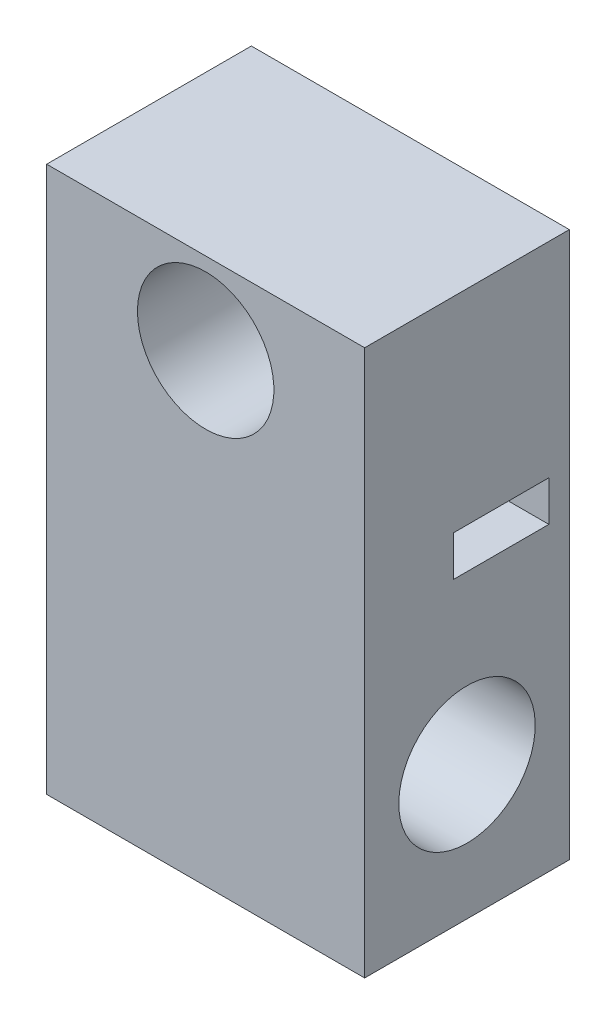
from build123d import *

# Parameters (mm, degrees)
SKETCH1_W           = 29.59652174
SKETCH1_H           = 50.8
SKETCH1_R           = 6.35
BOSS_EXTRUDE1_DEPTH = 19.05
SKETCH2_W           = 8.89
SKETCH2_H           = 3.758076141
CUT_EXTRUDE1_DEPTH  = 30.48
SKETCH3_R           = 6.35
CUT_EXTRUDE2_DEPTH  = 45.72


with BuildPart() as part:
    # Sketch1 → Boss-Extrude1 (new body)
    with BuildSketch(Plane.XY):
        Rectangle(SKETCH1_W, SKETCH1_H)
        with Locations((0, 17.78)):
            Circle(SKETCH1_R, mode=Mode.SUBTRACT)
    extrude(amount=BOSS_EXTRUDE1_DEPTH)

    # Sketch2 → Cut-Extrude1 (cut)
    with BuildSketch(Plane.ZY.offset(14.79826087)):
        with Locations((6.35, 4.47096193)):
            Rectangle(SKETCH2_W, SKETCH2_H)
    extrude(amount=-CUT_EXTRUDE1_DEPTH, mode=Mode.SUBTRACT)

    # Sketch3 → Cut-Extrude2 (cut)
    with BuildSketch(Plane.ZY.offset(14.79826087)):
        with Locations((9.525, -12.949755924)):
            Circle(SKETCH3_R)
    extrude(amount=-CUT_EXTRUDE2_DEPTH, mode=Mode.SUBTRACT)


solid = part.part
